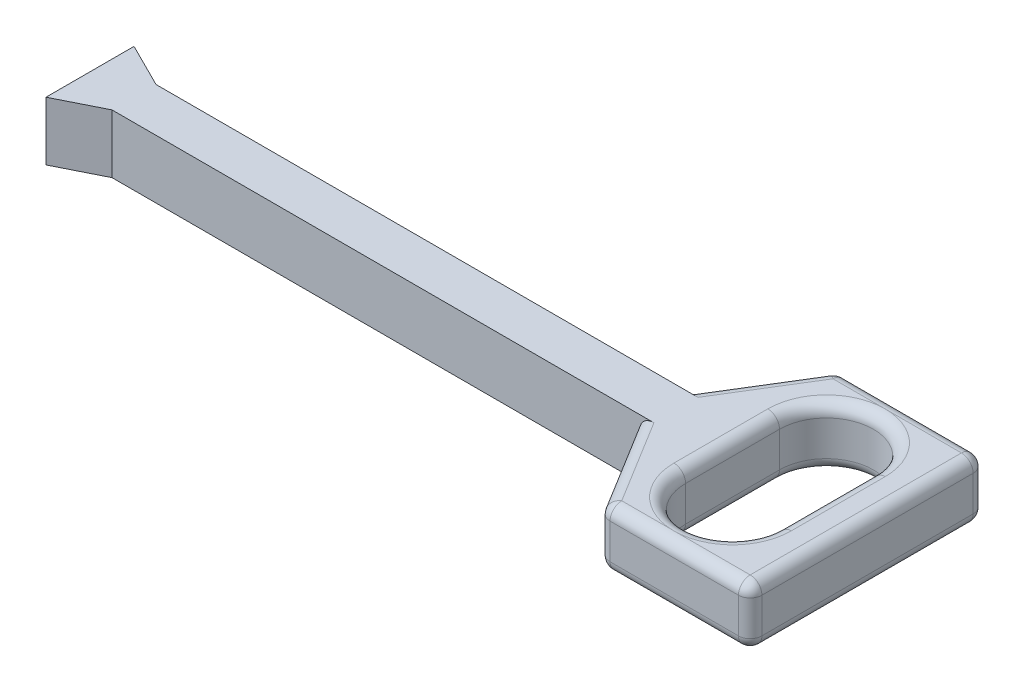
from build123d import *

# Parameters (mm, degrees)
BOSS_EXTRUDE1_DEPTH = 10
FILLET1_R           = 2
FILLET2_R           = 2


with BuildPart() as part:
    # Sketch1 → Boss-Extrude1 (new body)
    with BuildSketch(Plane(origin=(0, 0, 0), x_dir=(1, 0, 0), z_dir=(0, 1, 0))):
        Polygon((0, 0), (0, -7.5), (7.5, -3.75), (97.5, -3.75), (107.5, -20), (132.5, -20), (132.5, 20), (107.5, 20), (97.5, 3.75), (7.5, 3.75), (0, 7.5), align=None)
        with BuildLine():
            Line((125.5, 8), (125.5, -8))
            ThreePointArc((125.5, -8), (117.5, -16), (109.5, -8))
            Line((109.5, -8), (109.5, 8))
            ThreePointArc((109.5, 8), (117.5, 16), (125.5, 8))
        make_face(mode=Mode.SUBTRACT)
    extrude(amount=BOSS_EXTRUDE1_DEPTH)

    # Fillet1
    fillet1_edges = [part.edges().sort_by_distance(p)[0] for p in [
        (117.5, 0, -16),
        (109.5, 0, 0),
        (117.5, 0, 16),
        (125.5, 0, 0),
        (117.5, 10, -16),
        (109.5, 10, 0),
        (117.5, 10, 16),
        (125.5, 10, 0),
    ]]
    fillet(fillet1_edges, radius=FILLET1_R)

    # Fillet2
    fillet2_edges = [part.edges().sort_by_distance(p)[0] for p in [
        (102.5, 0, -11.875),
        (120, 0, -20),
        (132.5, 0, 0),
        (120, 0, 20),
        (102.5, 0, 11.875),
        (102.5, 10, 11.875),
        (107.5, 5, -20),
        (132.5, 5, -20),
        (132.5, 5, 20),
        (107.5, 5, 20),
        (120, 10, 20),
        (132.5, 10, 0),
        (120, 10, -20),
        (102.5, 10, -11.875),
    ]]
    fillet(fillet2_edges, radius=FILLET2_R - 0.0001)  # a hair under: the kernel refuses the full size


solid = part.part
